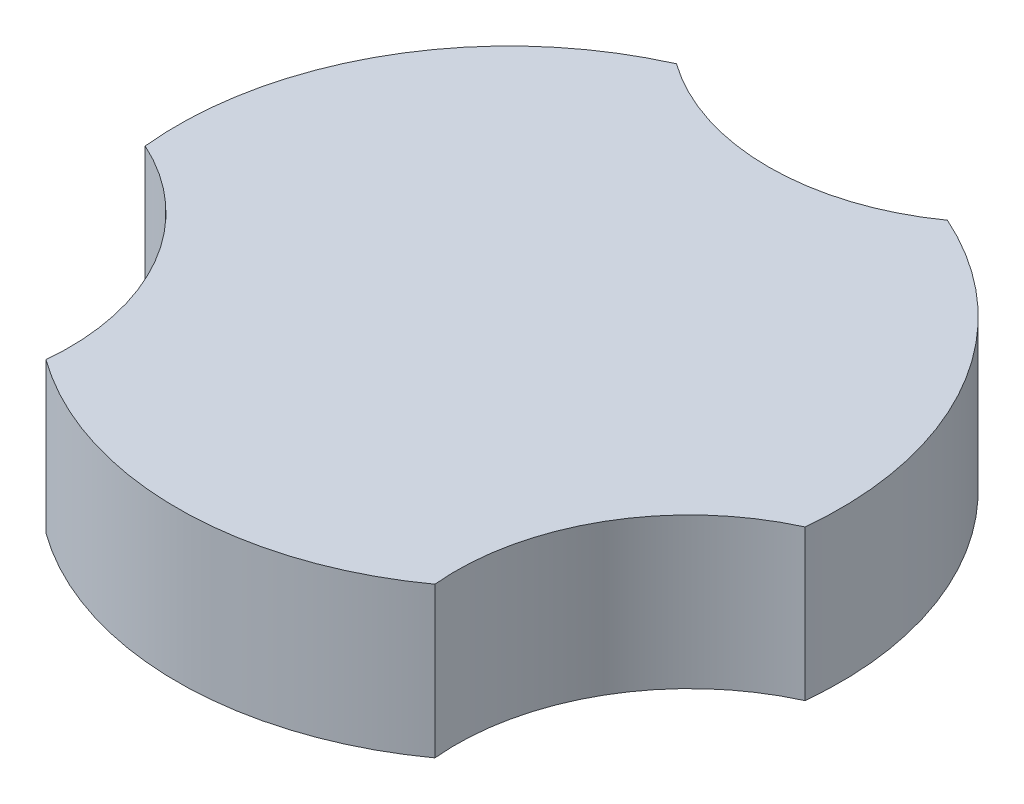
from build123d import *

# Parameters (mm, degrees)
LENS_DEPTH = 6.35


with BuildPart() as part:
    # Lens Sketch → Lens (new body)
    with BuildSketch(Plane(origin=(0, 0, 0), x_dir=(1, 0, 0), z_dir=(0, 1, 0))):
        with BuildLine():
            ThreePointArc((13.925943024, -1.438092792), (13.981473498, -0.719999187), (14, 0))
            ThreePointArc((14, 0), (11.748311638, 7.614274335), (5.717546621, 12.779266827))
            ThreePointArc((5.717546621, 12.779266827), (0, 10.95), (-5.717546621, 12.779266827))
            ThreePointArc((-5.717546621, 12.779266827), (-12.124355653, 7), (-13.925943024, -1.438092792))
            ThreePointArc((-13.925943024, -1.438092792), (-9.728304381, -5.072629445), (-8.163328399, -10.4))
            ThreePointArc((-8.163328399, -10.4), (-8.174601851, -10.871126227), (-8.208396403, -11.341174035))
            ThreePointArc((-8.208396403, -11.341174035), (0, -14), (8.208396403, -11.341174035))
            ThreePointArc((8.208396403, -11.341174035), (9.482978171, -5.475), (13.925943024, -1.438092792))
        make_face()
    extrude(amount=LENS_DEPTH)


solid = part.part
